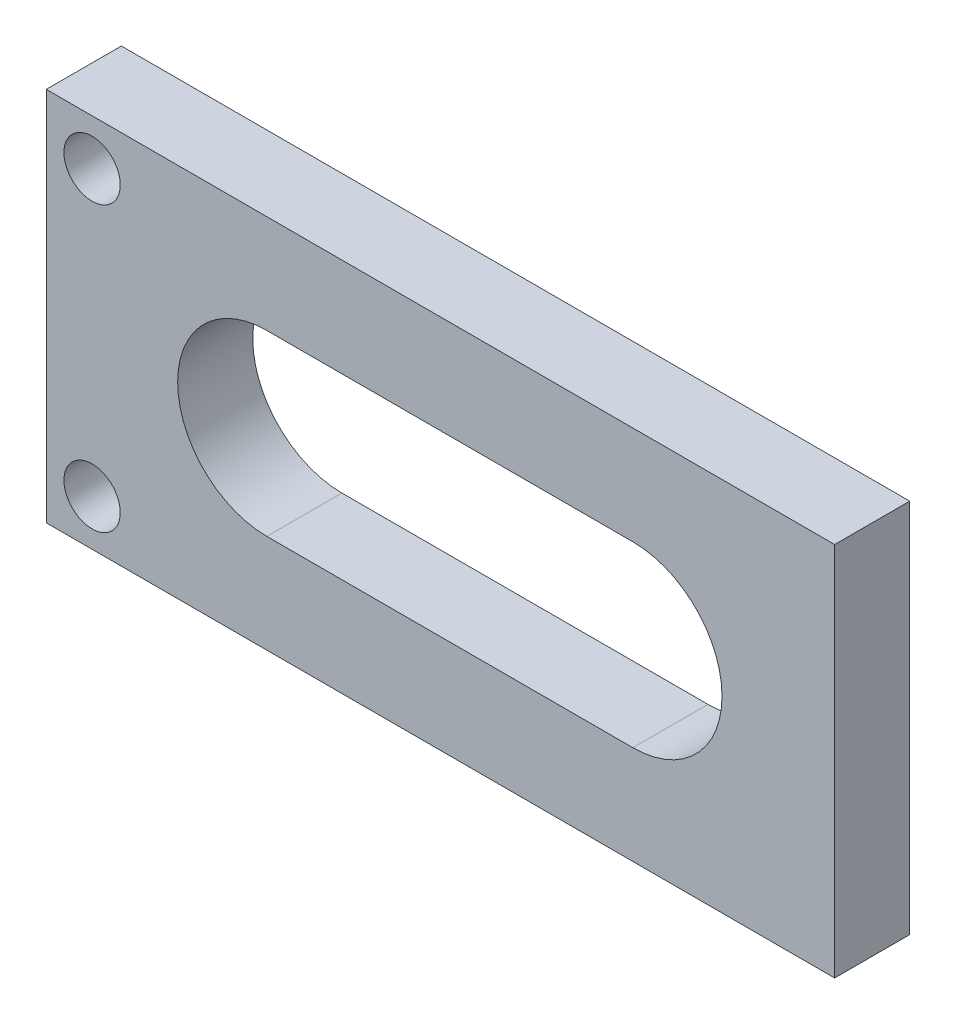
from build123d import *

# Parameters (mm, degrees)
SKETCH1_W           = 42
SKETCH1_H           = 20
SKETCH1_R           = 1.5
BOSS_EXTRUDE1_DEPTH = 4


with BuildPart() as part:
    # Sketch1 → Boss-Extrude1 (new body)
    with BuildSketch(Plane.XY):
        Rectangle(SKETCH1_W, SKETCH1_H)
        with Locations((-18.559305938, -7.559305938)):
            Circle(SKETCH1_R, mode=Mode.SUBTRACT)
        with Locations((-18.559305938, 7.559305938)):
            Circle(SKETCH1_R, mode=Mode.SUBTRACT)
        with BuildLine():
            Line((-9.25, 4.75), (10.25, 4.75))
            ThreePointArc((10.25, 4.75), (15, 0), (10.25, -4.75))
            Line((10.25, -4.75), (-9.25, -4.75))
            ThreePointArc((-9.25, -4.75), (-14, 0), (-9.25, 4.75))
        make_face(mode=Mode.SUBTRACT)
    extrude(amount=BOSS_EXTRUDE1_DEPTH)


solid = part.part
